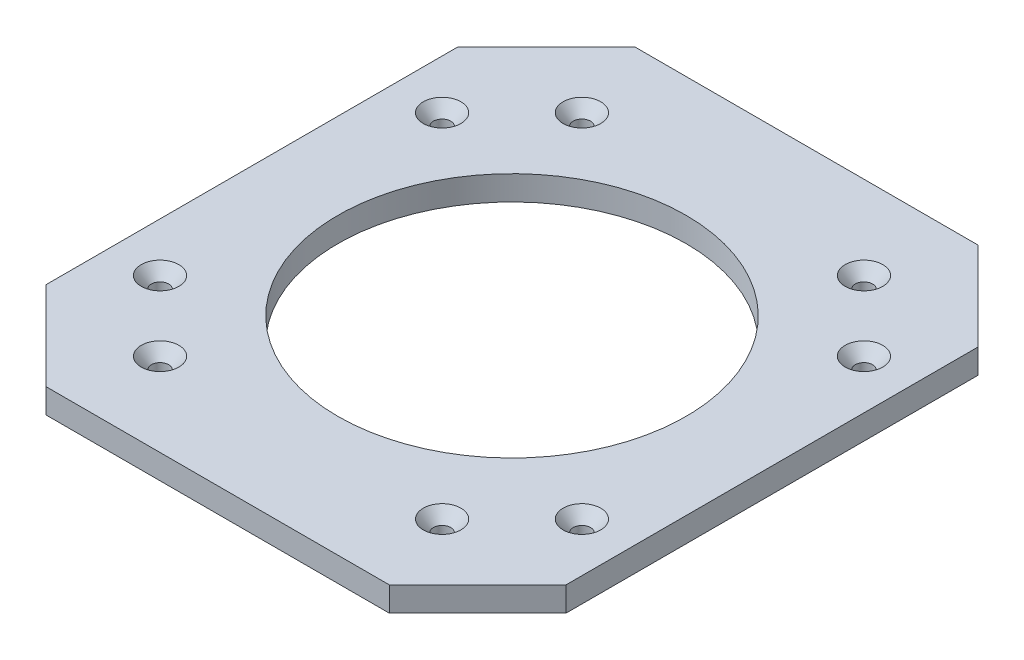
from build123d import *

# Parameters (mm, degrees)
BOSS_EXTRUDE1_DEPTH                            = 6.35
CSK_FOR_8_FLAT_HEAD_MACHINE_SCREW1_D           = 4.4958
CSK_FOR_8_FLAT_HEAD_MACHINE_SCREW1_CSINK_D     = 9.7576132
CSK_FOR_8_FLAT_HEAD_MACHINE_SCREW1_CSINK_ANGLE = 82
CIRPATTERN1_COUNT                              = 2
SKETCH4_R                                      = 45.085
CUT_EXTRUDE1_DEPTH                             = 102.869517521


with BuildPart() as part:
    # Sketch1 → Boss-Extrude1 (new body)
    with BuildSketch(Plane(origin=(0, 0, 0), x_dir=(1, 0, 0), z_dir=(0, 1, 0))):
        Polygon((-67.31, 53.34), (-44.45, 76.2), (44.45, 76.2), (67.31, 53.34), (67.31, -53.34), (44.45, -76.2), (-44.45, -76.2), (-67.31, -53.34), align=None)
    extrude(amount=BOSS_EXTRUDE1_DEPTH)

    # CSK for #8 Flat Head Machine Screw1 (through all)
    with Locations(Plane(origin=(0, 6.35, 0), x_dir=(-1, 0, 0), z_dir=(0, 1, 0))):
        with Locations((36.5125, -54.61), (-36.5125, -54.61), (36.5125, 54.61), (-36.5125, 54.61), (-54.61, -36.5125), (-54.61, 36.5125), (54.61, 36.5125), (54.61, -36.5125)):
            csk_for_8_flat_head_machine_screw1 = CounterSinkHole(CSK_FOR_8_FLAT_HEAD_MACHINE_SCREW1_D / 2, CSK_FOR_8_FLAT_HEAD_MACHINE_SCREW1_CSINK_D / 2, counter_sink_angle=CSK_FOR_8_FLAT_HEAD_MACHINE_SCREW1_CSINK_ANGLE)

    # CirPattern1: CSK for #8 Flat Head Machine Screw1 ×2 about axis
    cirpattern1_axis = Axis((0, 0, 0), (0, 1, 0))
    for i in range(1, CIRPATTERN1_COUNT):
        add(csk_for_8_flat_head_machine_screw1.rotate(cirpattern1_axis, i * 360 / CIRPATTERN1_COUNT), mode=Mode.SUBTRACT)

    # Sketch4 → Cut-Extrude1 (cut, through all)
    with BuildSketch(Plane(origin=(0, 6.35, 0), x_dir=(1, 0, 0), z_dir=(0, 1, 0))):
        Circle(SKETCH4_R)
    extrude(amount=-CUT_EXTRUDE1_DEPTH, mode=Mode.SUBTRACT)


solid = part.part
